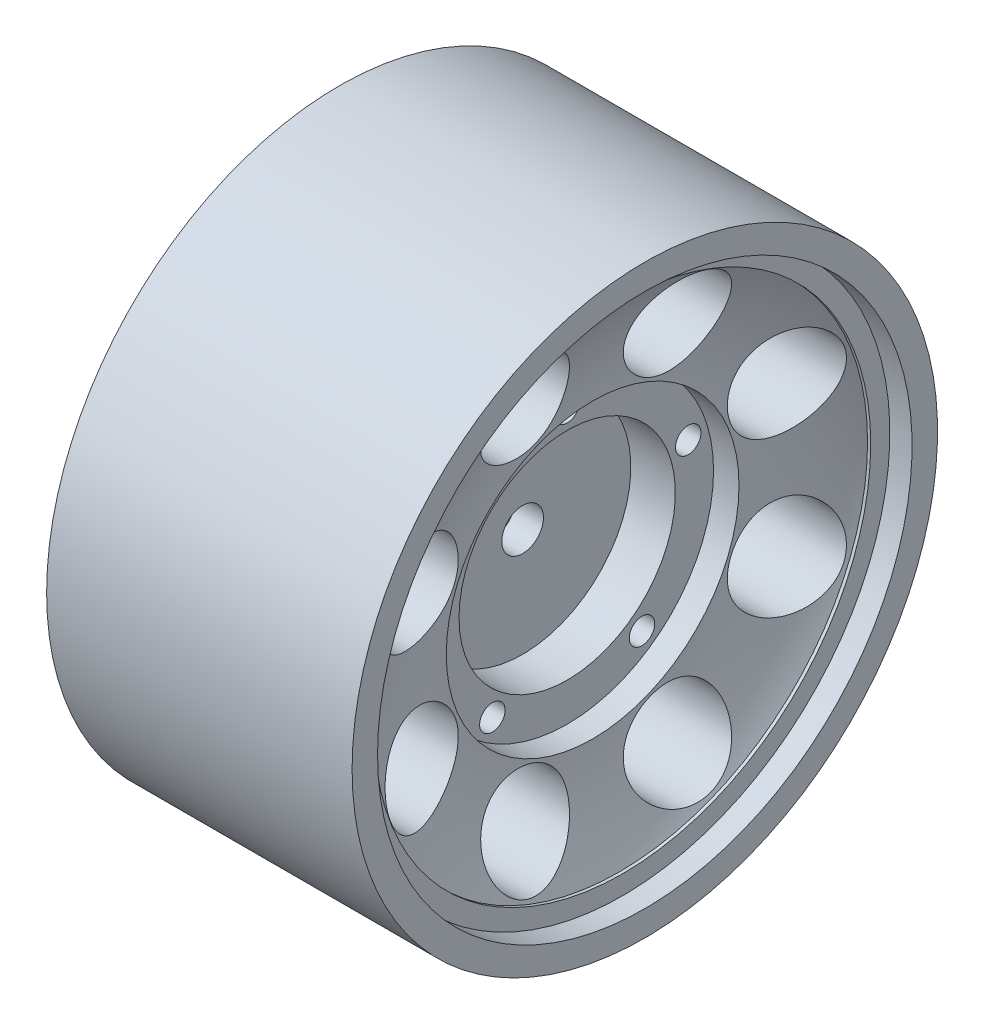
from build123d import *

# Parameters (mm, degrees)
CUT_EXTRUDE2_DEPTH      = 38.175260591
CUT_EXTRUDE2_DEPTH_BACK = 38.175260591
SKETCH2_R               = 3.75
CUT_EXTRUDE3_REACH      = 39.127
SKETCH3_R               = 1
CUT_EXTRUDE4_DEPTH      = 6.148


with BuildPart() as part:
    # Sketch1 → Revolve1 (revolve)
    with BuildSketch(Plane(origin=(0, 0, 0), x_dir=(1, 0, 0), z_dir=(0, 1, 0))):
        with BuildLine():
            Line((8.4, 1.6383), (8.4, 8.5))
            Line((8.4, 8.5), (11.9, 8.5))
            Line((11.9, 8.5), (11.9, 11.5))
            Line((11.9, 11.5), (13.9, 11.5))
            ThreePointArc((13.9, 11.5), (14.433745157, 15.635516896), (16, 19.5))
            Line((16, 19.5), (16.25, 19.5))
            Line((16.25, 19.5), (16.25, 21))
            Line((16.25, 21), (18, 21))
            Line((18, 21), (18, 23))
            Line((18, 23), (-6, 23))
            Line((-6, 23), (-6, 21.25))
            Line((-6, 21.25), (-4.25, 19.5))
            Line((-4.25, 19.5), (7, 19.5))
            Line((7, 19.5), (7, 8.5))
            Line((7, 8.5), (0, 8.5))
            Line((0, 8.5), (0, 1.6383))
            Line((0, 1.6383), (8.4, 1.6383))
        make_face()
    revolve(axis=Axis((0, 0, 0), (1, 0, 0)))

    # Sketch2 → Cut-Extrude2 (cut, two sides: drawn at the far end of the back side and taken through both)
    with BuildSketch(Plane(origin=(0, 0, 0), x_dir=(0, 0, -1), z_dir=(1, 0, 0)).offset(-CUT_EXTRUDE2_DEPTH_BACK)):
        with Locations((-5.931593202, 14.320132754)):
            Circle(SKETCH2_R)
        with Locations((5.931593202, 14.320132754)):
            Circle(SKETCH2_R)
        with Locations((14.320132754, 5.931593202)):
            Circle(SKETCH2_R)
        with Locations((14.320132754, -5.931593202)):
            Circle(SKETCH2_R)
        with Locations((5.931593202, -14.320132754)):
            Circle(SKETCH2_R)
        with Locations((-5.931593202, -14.320132754)):
            Circle(SKETCH2_R)
        with Locations((-14.320132754, -5.931593202)):
            Circle(SKETCH2_R)
        with Locations((-14.320132754, 5.931593202)):
            Circle(SKETCH2_R)
    extrude(amount=CUT_EXTRUDE2_DEPTH + CUT_EXTRUDE2_DEPTH_BACK, mode=Mode.SUBTRACT)

    # Sketch3 → Cut-Extrude3 (cut, up to next)
    with BuildSketch(Plane(origin=(11.9, 0, 0), x_dir=(0, 0, -1), z_dir=(1, 0, 0)), mode=Mode.PRIVATE) as cut_extrude3_sk1:
        with Locations((0, 10)):
            Circle(SKETCH3_R)
    cut_extrude3_tool1 = extrude(cut_extrude3_sk1.sketch, amount=-CUT_EXTRUDE3_REACH, mode=Mode.PRIVATE) & part.part
    # Sketch3 → Cut-Extrude3 (cut, up to next)
    with BuildSketch(Plane(origin=(11.9, 0, 0), x_dir=(0, 0, -1), z_dir=(1, 0, 0)), mode=Mode.PRIVATE) as cut_extrude3_sk2:
        with Locations((9.510565163, 3.090169944)):
            Circle(SKETCH3_R)
    cut_extrude3_tool2 = extrude(cut_extrude3_sk2.sketch, amount=-CUT_EXTRUDE3_REACH, mode=Mode.PRIVATE) & part.part
    # Sketch3 → Cut-Extrude3 (cut, up to next)
    with BuildSketch(Plane(origin=(11.9, 0, 0), x_dir=(0, 0, -1), z_dir=(1, 0, 0)), mode=Mode.PRIVATE) as cut_extrude3_sk3:
        with Locations((5.877852523, -8.090169944)):
            Circle(SKETCH3_R)
    cut_extrude3_tool3 = extrude(cut_extrude3_sk3.sketch, amount=-CUT_EXTRUDE3_REACH, mode=Mode.PRIVATE) & part.part
    # Sketch3 → Cut-Extrude3 (cut, up to next)
    with BuildSketch(Plane(origin=(11.9, 0, 0), x_dir=(0, 0, -1), z_dir=(1, 0, 0)), mode=Mode.PRIVATE) as cut_extrude3_sk4:
        with Locations((-5.877852523, -8.090169944)):
            Circle(SKETCH3_R)
    cut_extrude3_tool4 = extrude(cut_extrude3_sk4.sketch, amount=-CUT_EXTRUDE3_REACH, mode=Mode.PRIVATE) & part.part
    # Sketch3 → Cut-Extrude3 (cut, up to next)
    with BuildSketch(Plane(origin=(11.9, 0, 0), x_dir=(0, 0, -1), z_dir=(1, 0, 0)), mode=Mode.PRIVATE) as cut_extrude3_sk5:
        with Locations((-9.510565163, 3.090169944)):
            Circle(SKETCH3_R)
    cut_extrude3_tool5 = extrude(cut_extrude3_sk5.sketch, amount=-CUT_EXTRUDE3_REACH, mode=Mode.PRIVATE) & part.part
    add(cut_extrude3_tool1.solids().sort_by_distance((11.9, 10, 0))[0], mode=Mode.SUBTRACT)
    add(cut_extrude3_tool2.solids().sort_by_distance((11.9, 3.09017, -9.510565))[0], mode=Mode.SUBTRACT)
    add(cut_extrude3_tool3.solids().sort_by_distance((11.9, -8.09017, -5.877853))[0], mode=Mode.SUBTRACT)
    add(cut_extrude3_tool4.solids().sort_by_distance((11.9, -8.09017, 5.877853))[0], mode=Mode.SUBTRACT)
    add(cut_extrude3_tool5.solids().sort_by_distance((11.9, 3.09017, 9.510565))[0], mode=Mode.SUBTRACT)

    # Sketch4 → Cut-Extrude4 (cut)
    with BuildSketch(Plane.ZY):
        Polygon((6.92820323, 0), (3.464101615, 6), (-3.464101615, 6), (-6.92820323, 0), (-3.464101615, -6), (3.464101615, -6), align=None)
    extrude(amount=-CUT_EXTRUDE4_DEPTH, mode=Mode.SUBTRACT)


solid = part.part
